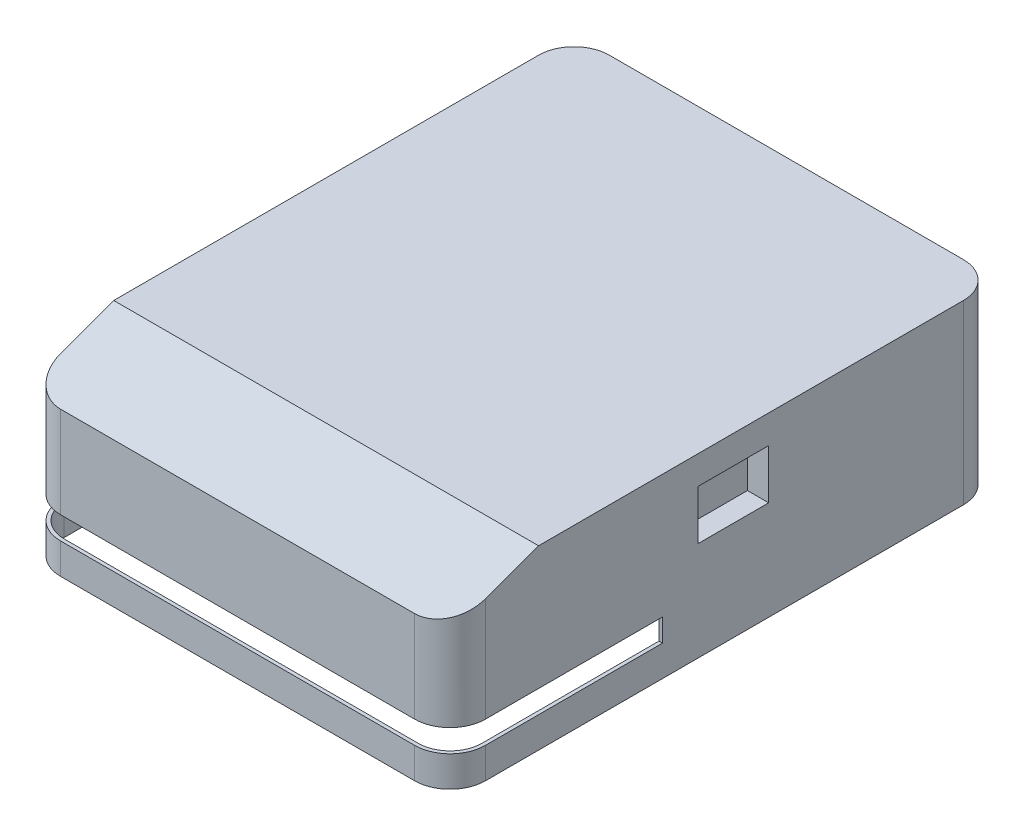
from build123d import *

# Parameters (mm, degrees)
BOSS_EXTRUDE1_DEPTH     = 200
BOSS_EXTRUDE2_DEPTH     = 50
DRAFT2_START            = 200
DRAFT2_DEPTH            = 50
DRAFT2_START_2          = 192.170637281
DRAFT2_2_OUTLINE_W      = 602
DRAFT2_2_OUTLINE_H      = 136
DRAFT2_2_DEPTH          = 43.829362719
SKETCH12_W              = 100
SKETCH12_H              = 70
CUT_EXTRUDE4_DEPTH      = 30
SKETCH14_W              = 100
SKETCH14_H              = 70
CUT_EXTRUDE5_DEPTH      = 30
SKETCH13_W              = 100
SKETCH13_H              = 70
CUT_EXTRUDE2_DEPTH      = 30
SHELL1_T                = -5
CUT_EXTRUDE6_DEPTH      = 1012.496416207
CUT_EXTRUDE6_DEPTH_BACK = 1012.496416207
SKETCH15_W              = 300
SKETCH15_H              = 32


with BuildPart() as part:
    # Sketch1 → Boss-Extrude1 (new body)
    with BuildSketch(Plane(origin=(0, 0, 0), x_dir=(1, 0, 0), z_dir=(0, 1, 0))):
        with BuildLine():
            Line((50, 0), (550, 0))
            ThreePointArc((550, 0), (585.355339059, 14.644660941), (600, 50))
            Line((600, 50), (600, 725))
            ThreePointArc((600, 725), (585.355339059, 760.355339059), (550, 775))
            Line((550, 775), (50, 775))
            ThreePointArc((50, 775), (14.644660941, 760.355339059), (0, 725))
            Line((0, 725), (0, 50))
            ThreePointArc((0, 50), (14.644660941, 14.644660941), (50, 0))
        make_face()
    extrude(amount=BOSS_EXTRUDE1_DEPTH)

    # Sketch5 → Boss-Extrude2 (add)
    with BuildSketch(Plane(origin=(0, 200, 0), x_dir=(1, 0, 0), z_dir=(0, 1, 0))):
        with BuildLine():
            Line((600, 125), (0, 125))
            Line((0, 125), (0, 725))
            ThreePointArc((0, 725), (14.644660941, 760.355339059), (50, 775))
            Line((50, 775), (550, 775))
            ThreePointArc((550, 775), (585.355339059, 760.355339059), (600, 725))
            Line((600, 725), (600, 125))
        make_face()
    extrude(amount=BOSS_EXTRUDE2_DEPTH)

    # Draft2: read off the stored shape, not the designer's step
    # Draft2 outline → Draft2 (add)
    with BuildSketch(Plane(origin=(0, 0, 0), x_dir=(1, 0, 0), z_dir=(0, 1, 0)).offset(DRAFT2_START)):
        with BuildLine():
            ThreePointArc((550, 0), (585.355339059, 14.644660941), (600, 50))
            Line((600, 50), (600, 125))
            Line((600, 125), (0, 125))
            Line((0, 125), (0, 50))
            ThreePointArc((0, 50), (14.644660941, 14.644660941), (50, 0))
            Line((50, 0), (550, 0))
        make_face()
    extrude(amount=DRAFT2_DEPTH)

    # Draft2 2 outline → Draft2 2 (cut)
    with BuildSketch(Plane(origin=(0, 0, 0), x_dir=(1, 0, 0), z_dir=(0, 0.9396926207859094, 0.34202014332566616)).offset(DRAFT2_START_2)):
        with Locations((300, 136)):
            Rectangle(DRAFT2_2_OUTLINE_W, DRAFT2_2_OUTLINE_H)
    extrude(amount=DRAFT2_2_DEPTH, mode=Mode.SUBTRACT)

    # Sketch12 → Cut-Extrude4 (cut)
    with BuildSketch(Plane(origin=(0, 0, 0), x_dir=(0, 0, -1), z_dir=(1, 0, 0))):
        with Locations((400, 175)):
            Rectangle(SKETCH12_W, SKETCH12_H)
    extrude(amount=CUT_EXTRUDE4_DEPTH, mode=Mode.SUBTRACT)

    # Sketch14 → Cut-Extrude5 (cut)
    with BuildSketch(Plane(origin=(600, 0, 0), x_dir=(0, 0, -1), z_dir=(1, 0, 0))):
        with Locations((400, 175)):
            Rectangle(SKETCH14_W, SKETCH14_H)
    extrude(amount=-CUT_EXTRUDE5_DEPTH, mode=Mode.SUBTRACT)

    # Sketch13 → Cut-Extrude2 (cut)
    with BuildSketch(Plane(origin=(0, 0, -775), x_dir=(-1, 0, 0), z_dir=(0, 0, -1))):
        with Locations((-300, 175)):
            Rectangle(SKETCH13_W, SKETCH13_H)
    extrude(amount=-CUT_EXTRUDE2_DEPTH, mode=Mode.SUBTRACT)

    # Shell1
    shell1_openings = [part.faces().sort_by_distance(p)[0] for p in [
        (300, 0, -387.5),
    ]]
    offset(amount=SHELL1_T, openings=shell1_openings, kind=Kind.INTERSECTION)

    # Sketch15 → Cut-Extrude6 (cut, two sides: drawn at the far end of the back side and taken through both)
    with BuildSketch(Plane.ZY.offset(-CUT_EXTRUDE6_DEPTH_BACK)):
        with Locations((-150, 59.4)):
            Rectangle(SKETCH15_W, SKETCH15_H)
    extrude(amount=CUT_EXTRUDE6_DEPTH + CUT_EXTRUDE6_DEPTH_BACK, mode=Mode.SUBTRACT)


solid = part.part
